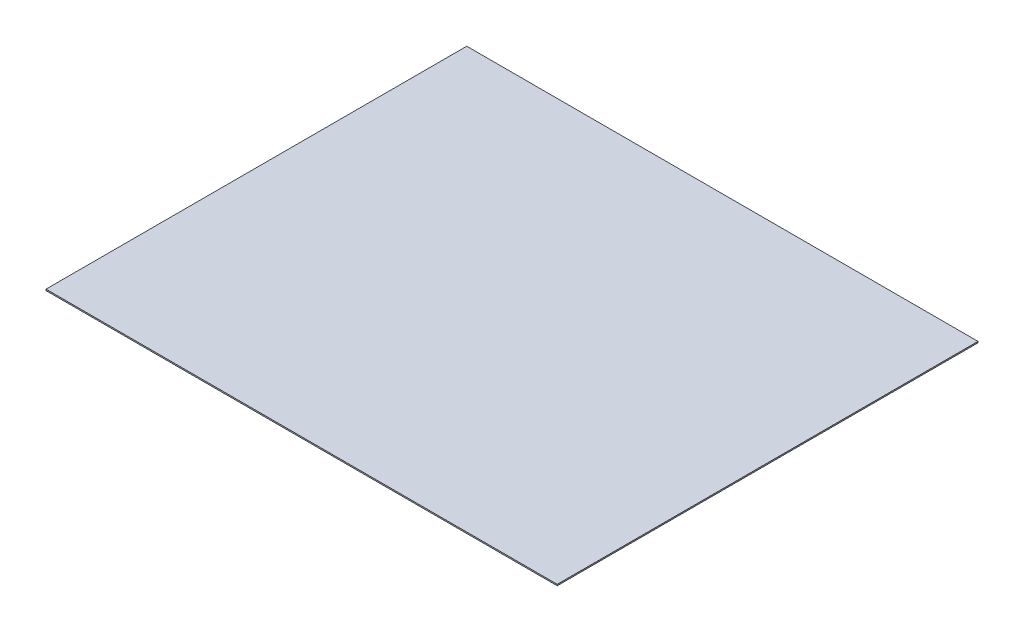
from build123d import *

# Parameters (mm, degrees)
SKETCH1_W           = 625.602
SKETCH1_H           = 514.87578
BOSS_EXTRUDE1_DEPTH = 1.5875


with BuildPart() as part:
    # Sketch1 → Boss-Extrude1 (new body)
    with BuildSketch(Plane(origin=(0, 0, 0), x_dir=(1, 0, 0), z_dir=(0, 1, 0))):
        with Locations((312.801, 257.43789)):
            Rectangle(SKETCH1_W, SKETCH1_H)
    extrude(amount=BOSS_EXTRUDE1_DEPTH)


solid = part.part
